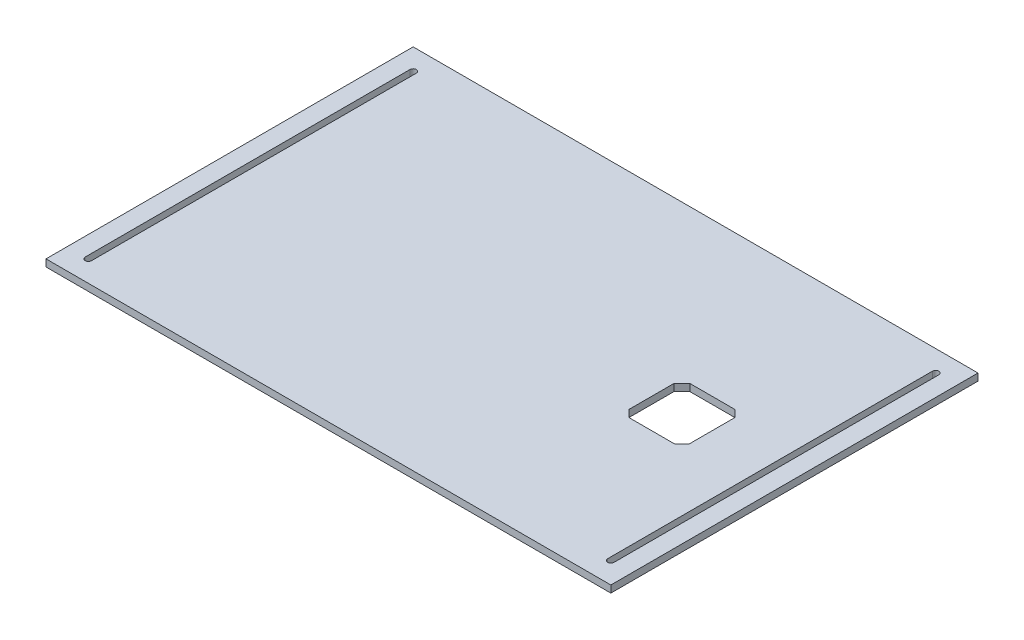
from build123d import *

# Parameters (mm, degrees)
SKETCH_1_W          = 400
SKETCH_1_H          = 260
EXTRUDE_1_DEPTH     = 5
CUT_EXTRUDE_1_DEPTH = 239.589605809
CUT_EXTRUDE_2_DEPTH = 239.589605809


with BuildPart() as part:
    # 草圖1 → 填料-伸長1 (new body)
    with BuildSketch(Plane(origin=(0, 0, 0), x_dir=(1, 0, 0), z_dir=(0, 1, 0))):
        Rectangle(SKETCH_1_W, SKETCH_1_H)
    extrude(amount=EXTRUDE_1_DEPTH)

    # 草圖2 → 除料-伸長1 (cut, through all)
    with BuildSketch(Plane(origin=(0, 5, 0), x_dir=(1, 0, 0), z_dir=(0, 1, 0))):
        with BuildLine():
            Line((-182.75, 115), (-182.75, -115))
            ThreePointArc((-182.75, -115), (-185, -117.25), (-187.25, -115))
            Line((-187.25, -115), (-187.25, 115))
            ThreePointArc((-187.25, 115), (-185, 117.25), (-182.75, 115))
        make_face()
        with BuildLine():
            Line((182.75, 115), (182.75, -115))
            ThreePointArc((182.75, -115), (185, -117.25), (187.25, -115))
            Line((187.25, -115), (187.25, 115))
            ThreePointArc((187.25, 115), (185, 117.25), (182.75, 115))
        make_face()
    extrude(amount=-CUT_EXTRUDE_1_DEPTH, mode=Mode.SUBTRACT)

    # 草圖3 → 除料-伸長2 (cut, through all)
    with BuildSketch(Plane(origin=(0, 5, 0), x_dir=(1, 0, 0), z_dir=(0, 1, 0))):
        Polygon((104.4, 21.575), (136.25, 21.575), (141.25, 16.575), (141.25, -15.925), (136.25, -20.925), (103.75, -20.925), (98.75, -15.925), (98.75, 15.925), align=None)
    extrude(amount=-CUT_EXTRUDE_2_DEPTH, mode=Mode.SUBTRACT)


solid = part.part
